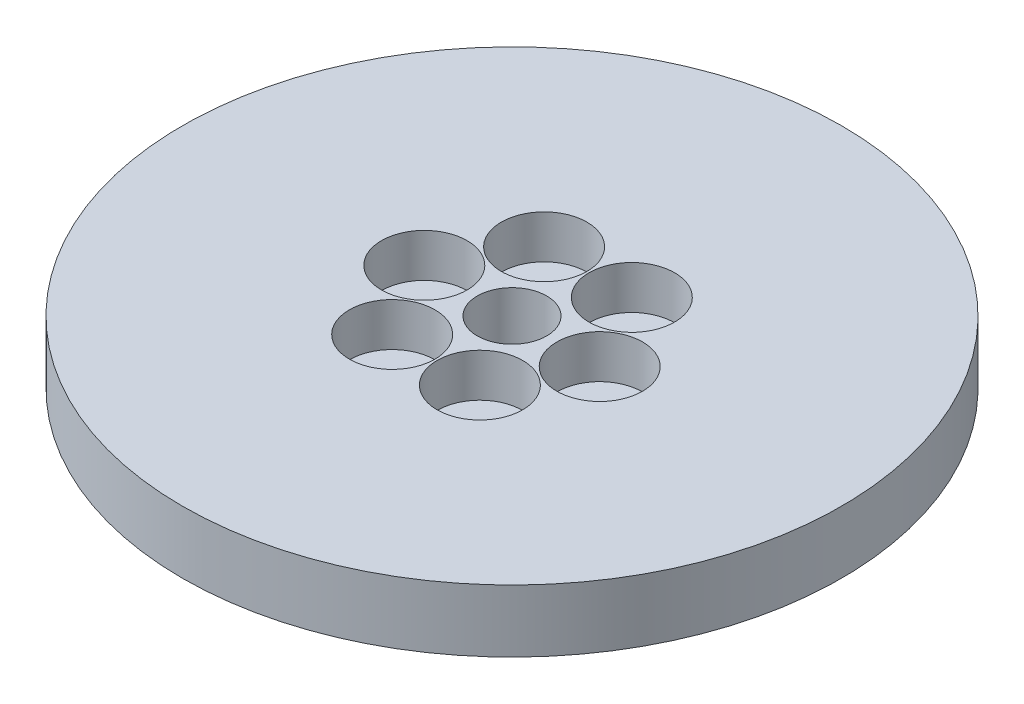
from build123d import *

# Parameters (mm, degrees)
SKETCH1_R           = 47.5
BOSS_EXTRUDE1_DEPTH = 9
SKETCH2_R           = 5
CUT_EXTRUDE1_DEPTH  = 68.775364256
SKETCH3_R           = 6.168326872
CUT_EXTRUDE2_DEPTH  = 6.24147409
CIRPATTERN1_COUNT   = 6


with BuildPart() as part:
    # Sketch1 → Boss-Extrude1 (new body)
    with BuildSketch(Plane(origin=(0, 0, 0), x_dir=(1, 0, 0), z_dir=(0, 1, 0))):
        Circle(SKETCH1_R)
    extrude(amount=BOSS_EXTRUDE1_DEPTH)

    # Sketch2 → Cut-Extrude1 (cut, through all)
    with BuildSketch(Plane(origin=(0, 0, 0), x_dir=(1, 0, 0), z_dir=(0, 1, 0))):
        Circle(SKETCH2_R)
    extrude(amount=CUT_EXTRUDE1_DEPTH, mode=Mode.SUBTRACT)

    # Sketch3 → Cut-Extrude2 (cut)
    with BuildSketch(Plane(origin=(0, 9, 0), x_dir=(1, 0, 0), z_dir=(0, 1, 0))):
        with Locations((-12.641897638, 0)):
            Circle(SKETCH3_R)
    cut_extrude2 = extrude(amount=-CUT_EXTRUDE2_DEPTH, mode=Mode.SUBTRACT)

    # CirPattern1: Cut-Extrude2 ×6 about axis
    cirpattern1_axis = Axis((0, 0, 0), (0, 1, 0))
    for i in range(1, CIRPATTERN1_COUNT):
        add(cut_extrude2.rotate(cirpattern1_axis, i * 360 / CIRPATTERN1_COUNT), mode=Mode.SUBTRACT)


solid = part.part
